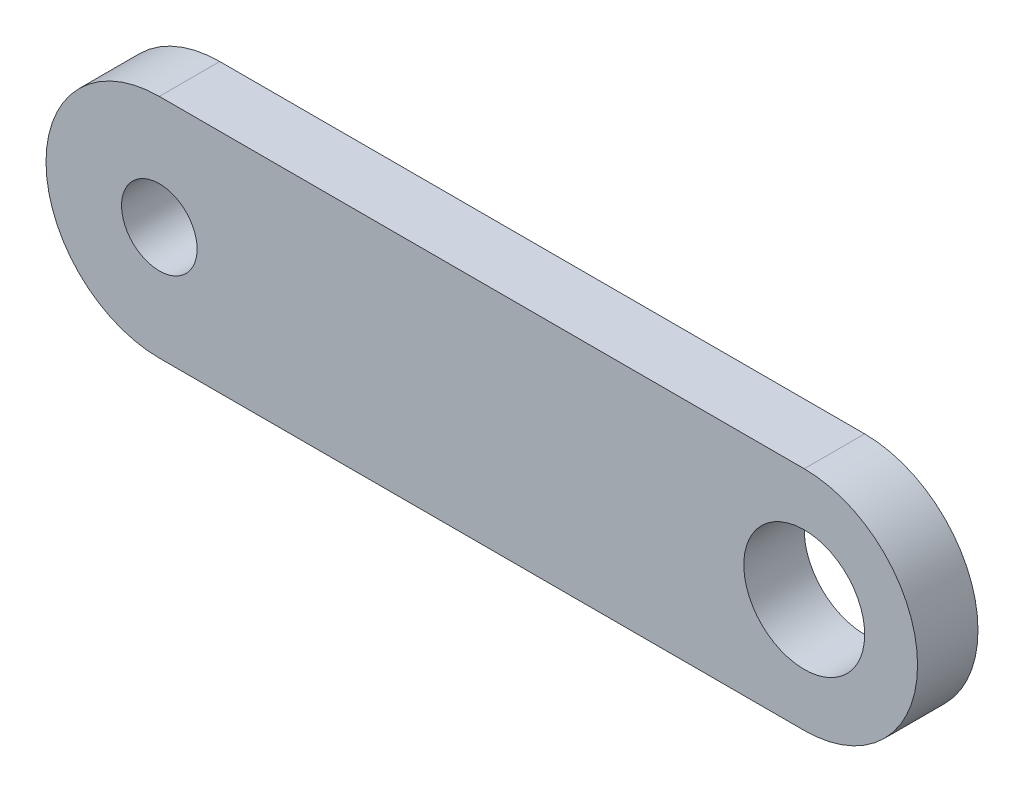
from build123d import *

# Parameters (mm, degrees)
SKETCH1_R           = 2.54
SKETCH1_R_2         = 1.5875
BOSS_EXTRUDE2_DEPTH = 2.54


with BuildPart() as part:
    # Sketch1 → Boss-Extrude2 (new body)
    with BuildSketch(Plane.XY):
        with BuildLine():
            Line((27.1018, 4.7625), (0, 4.7625))
            ThreePointArc((0, 4.7625), (-4.7625, 0), (0, -4.7625))
            Line((0, -4.7625), (27.1018, -4.7625))
            ThreePointArc((27.1018, -4.7625), (31.8643, 0), (27.1018, 4.7625))
        make_face()
        with Locations((27.1018, 0)):
            Circle(SKETCH1_R, mode=Mode.SUBTRACT)
        Circle(SKETCH1_R_2, mode=Mode.SUBTRACT)
    extrude(amount=BOSS_EXTRUDE2_DEPTH)


solid = part.part
